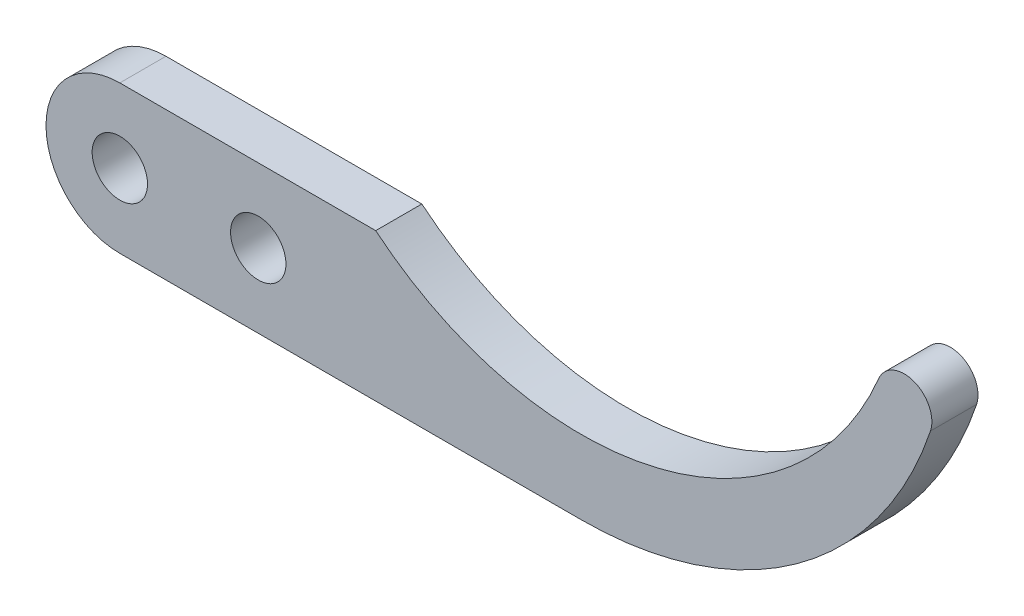
from build123d import *

# Parameters (mm, degrees)
ESQUISSE1_R        = 3
BOSS_EXTRU_1_DEPTH = 5


with BuildPart() as part:
    # Esquisse1 → Boss.-Extru.1 (new body)
    with BuildSketch(Plane.XY):
        with BuildLine():
            Line((0, 8), (20, 8))
            Line((20, 8), (27.728942549, 8))
            ThreePointArc((27.728942549, 8), (58.337637956, 1.007592122), (82.236842105, 21.369665775))
            ThreePointArc((82.236842105, 21.369665775), (86.060641355, 23.007601565), (87.845148494, 19.249968185))
            ThreePointArc((87.845148494, 19.249968185), (73.317461433, -0.478698562), (50, -8))
            Line((50, -8), (0, -8))
            ThreePointArc((0, -8), (-8, 0), (0, 8))
        make_face()
        Circle(ESQUISSE1_R, mode=Mode.SUBTRACT)
        with Locations((15, 0)):
            Circle(ESQUISSE1_R, mode=Mode.SUBTRACT)
    extrude(amount=BOSS_EXTRU_1_DEPTH)


solid = part.part
